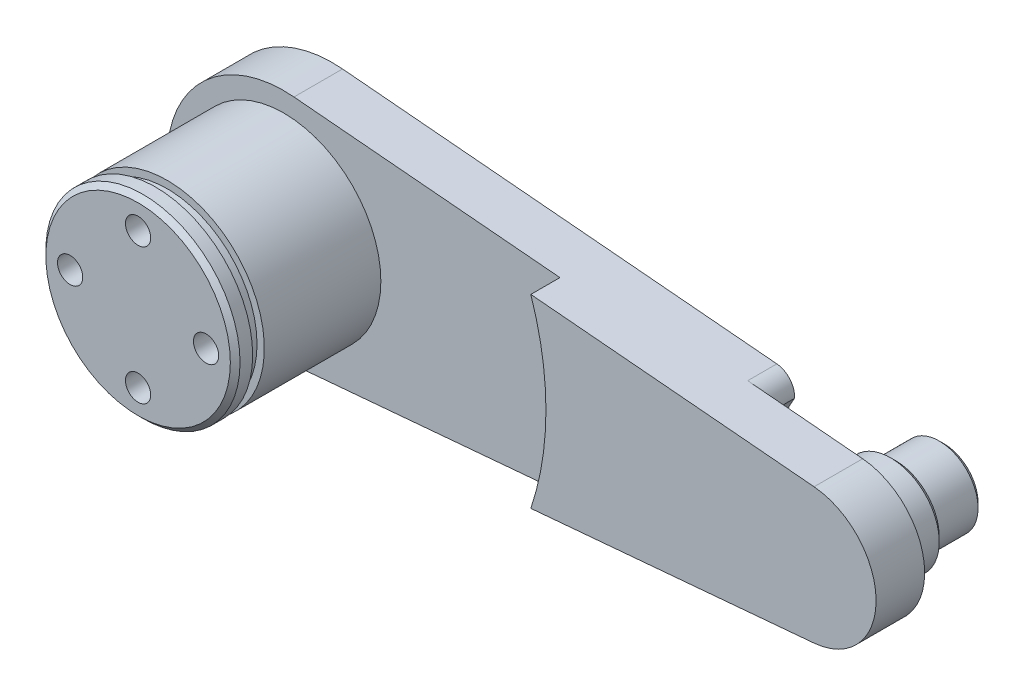
from build123d import *

# Parameters (mm, degrees)
EXTRUDE_1_DEPTH     = 5
SKETCH_2_R          = 10
EXTRUDE_2_DEPTH     = 15
SKETCH_3_R          = 4
EXTRUDE_3_DEPTH     = 6
SKETCH_4_R          = 5
SKETCH_4_R_2        = 4
EXTRUDE_4_DEPTH     = 1
CHAMFER_1_SIZE      = 0.5
SKETCH_6_R          = 1.3
CUT_EXTRUDE_2_DEPTH = 6
SKETCH_11_R         = 2.2
CUT_EXTRUDE_7_DEPTH = 10
CUT_EXTRUDE_START   = -5
CUT_EXTRUDE_8_DEPTH = 5
CUT_EXTRUDE_START_2 = -3
SKETCH_14_R         = 11.075
SKETCH_14_R_2       = 5
CUT_EXTRUDE_9_DEPTH = 3
EXTRUDE_START       = -1
EXTRUDE_5_DEPTH     = 1
FILLET_1_R          = 2
SKETCH_16_W         = 4.663078912
SKETCH_16_H         = 1.2
EXTRUDE_6_DEPTH     = 4
EXTRUDE_7_DEPTH     = 1
EXTRUDE_8_DEPTH     = 3


with BuildPart() as part:
    # 草图1 → 凸台-拉伸1 (new body)
    with BuildSketch(Plane.XY):
        with BuildLine():
            Line((57.614035088, 6.973016629), (1.052631579, 11.953742793))
            ThreePointArc((1.052631579, 11.953742793), (-12, 0), (1.052631579, -11.953742793))
            Line((1.052631579, -11.953742793), (57.614035088, -6.973016629))
            ThreePointArc((57.614035088, -6.973016629), (64, 0), (57.614035088, 6.973016629))
        make_face()
    extrude(amount=EXTRUDE_1_DEPTH)

    # 草图2 → 凸台-拉伸2 (add)
    with BuildSketch(Plane.XY.offset(5)):
        Circle(SKETCH_2_R)
    extrude(amount=EXTRUDE_2_DEPTH)

    # 草图3 → 凸台-拉伸3 (add)
    with BuildSketch(Plane(origin=(0, 0, 0), x_dir=(-1, 0, 0), z_dir=(0, 0, -1))):
        with Locations((-57, 0)):
            Circle(SKETCH_3_R)
    extrude(amount=EXTRUDE_3_DEPTH)

    # 草图4 → 凸台-拉伸4 (add)
    with BuildSketch(Plane(origin=(0, 0, 0), x_dir=(-1, 0, 0), z_dir=(0, 0, -1))):
        with Locations(Location((-57, 0, 0), (0, 0, 180))):
            Circle(SKETCH_4_R)
        with Locations((-57, 0)):
            Circle(SKETCH_4_R_2, mode=Mode.SUBTRACT)
    extrude(amount=EXTRUDE_4_DEPTH)

    # 倒角1
    chamfer_1_edges = [part.edges().sort_by_distance(p)[0] for p in [
        (-10, 0, 20),
        (61, 0, -6),
        (52, 0, -1),
    ]]
    chamfer(chamfer_1_edges, length=CHAMFER_1_SIZE)

    # 草图6 → 切除-拉伸2 (cut)
    with BuildSketch(Plane.XY.offset(20)):
        with Locations((0, 7)):
            Circle(SKETCH_6_R)
        with Locations((7, 0)):
            Circle(SKETCH_6_R)
        with Locations((0, -7)):
            Circle(SKETCH_6_R)
        with Locations((-7, 0)):
            Circle(SKETCH_6_R)
    extrude(amount=-CUT_EXTRUDE_2_DEPTH, mode=Mode.SUBTRACT)

    # 草图11 → 切除-拉伸7 (cut)
    with BuildSketch(Plane(origin=(0, 0, -6), x_dir=(-1, 0, 0), z_dir=(0, 0, -1))):
        with Locations((-57, 0)):
            Circle(SKETCH_11_R)
    extrude(amount=-CUT_EXTRUDE_7_DEPTH, mode=Mode.SUBTRACT)

    # 草图12 → 切除-拉伸8 (cut)
    with BuildSketch(Plane.XY.offset(5).offset(CUT_EXTRUDE_START)):
        with BuildLine():
            Line((57.438596491, 4.980726164), (7.48487293, 9.379588329))
            ThreePointArc((7.48487293, 9.379588329), (10.812457518, 5.204878713), (12, 0))
            ThreePointArc((12, 0), (10.812457518, -5.204878713), (7.48487293, -9.379588329))
            Line((7.48487293, -9.379588329), (57.438596491, -4.980726164))
            ThreePointArc((57.438596491, -4.980726164), (52, 0), (57.438596491, 4.980726164))
        make_face()
    extrude(amount=CUT_EXTRUDE_8_DEPTH, mode=Mode.SUBTRACT)

    # 草图14 → 切除-拉伸9 (cut)
    with BuildSketch(Plane(origin=(0, 0, 0), x_dir=(-1, 0, 0), z_dir=(0, 0, -1)).offset(CUT_EXTRUDE_START_2)):
        with Locations((-57, 0)):
            Circle(SKETCH_14_R)
        with Locations(Location((-57, 0, 0), (0, 0, 95.032413496))):
            Circle(SKETCH_14_R_2, mode=Mode.SUBTRACT)
    extrude(amount=CUT_EXTRUDE_9_DEPTH, mode=Mode.SUBTRACT)

    # 草图15 → 凸台-拉伸5 (add)
    with BuildSketch(Plane.XY.offset(5).offset(EXTRUDE_START)):
        with BuildLine():
            Line((1.052631579, -11.953742793), (57.614035088, -6.973016629))
            ThreePointArc((57.614035088, -6.973016629), (64, 0), (57.614035088, 6.973016629))
            Line((57.614035088, 6.973016629), (1.052631579, 11.953742793))
            ThreePointArc((1.052631579, 11.953742793), (-12, 0), (1.052631579, -11.953742793))
        make_face()
    extrude(amount=EXTRUDE_5_DEPTH)

    # 圆角1
    # the kernel refuses this fillet: 2 mm, written as the material it takes off along each edge
    with BuildSketch(Plane(origin=(49.064832266, -7.725848694, -8.249501326), x_dir=(-0.6163800221199659, 0.7874488353736963, 0), z_dir=(0, 0, 1))) as fillet_1_piece_1:
        with BuildLine():
            CenterArc((3.475122508, 1.676963653), FILLET_1_R, 146.980149767, 90)
            Line((1.798158856, 2.766822775), (0, 0))
            ThreePointArc((0, 0), (1.192631693, 0.064402621), (2.385263386, 0))
        make_face()
    extrude(amount=11.249501326, mode=Mode.SUBTRACT)
    with BuildSketch(Plane(origin=(49.064832266, 7.725848694, -8.249501326), x_dir=(-0.9961452327423431, 0.08771929824561424, 0), z_dir=(0, 0, 1))) as fillet_1_piece_2:
        with BuildLine():
            CenterArc((3.29980053, 2), FILLET_1_R, 180, 90)
            ThreePointArc((1.29980053, 2), (0.703900692, 0.964905108), (0, 0))
            Line((0, 0), (3.29980053, 0))
        make_face()
    extrude(amount=11.249501326, mode=Mode.SUBTRACT)

    # 草图16 → 切除-旋转1 (revolve, cut)
    with BuildSketch(Plane(origin=(0, 0, 0), x_dir=(1, 0, 0), z_dir=(0, 1, 0))):
        with Locations((11.581539456, -17.6)):
            Rectangle(SKETCH_16_W, SKETCH_16_H)
    revolve(axis=Axis((0, 0, 20), (0, 0, -1)), mode=Mode.SUBTRACT)

    # 草图17 → 凸台-拉伸6 (add)
    # profile 1 of 2: a face of its own
    with BuildSketch(Plane(origin=(0, 0, 4), x_dir=(-1, 0, 0), z_dir=(0, 0, -1))):
        with BuildLine():
            ThreePointArc((-7.48487293, -9.379588329), (-12, 0), (-7.48487293, 9.379588329))
            Line((-7.48487293, 9.379588329), (-47.594603568, 5.847575819))
            ThreePointArc((-47.594603568, 5.847575819), (-45.925, 0), (-47.594603568, -5.847575819))
            Line((-47.594603568, -5.847575819), (-7.48487293, -9.379588329))
        make_face()
        with BuildLine():
            Line((-43.563456974, -2.155807668), (-43.563456974, 2.155807668))
            Line((-43.563456974, 2.155807668), (-15.344753505, 4.640711258))
            ThreePointArc((-15.344753505, 4.640711258), (-16.031146594, 0), (-15.344753505, -4.640711258))
            Line((-15.344753505, -4.640711258), (-43.563456974, -2.155807668))
        make_face(mode=Mode.SUBTRACT)
    # profile 2 of 2: a face of its own
    with BuildSketch(Plane(origin=(0, 0, 4), x_dir=(-1, 0, 0), z_dir=(0, 0, -1))):
        with BuildLine():
            ThreePointArc((-15.344753505, 4.640711258), (-16.031146594, 0), (-15.344753505, -4.640711258))
            Line((-15.344753505, -4.640711258), (-43.563456974, -2.155807668))
            Line((-43.563456974, -2.155807668), (-43.563456974, 2.155807668))
            Line((-43.563456974, 2.155807668), (-15.344753505, 4.640711258))
        make_face()
    extrude(amount=EXTRUDE_6_DEPTH)

    # 草图18 → 凸台-拉伸7 (add)
    with BuildSketch(Plane(origin=(0, 0, 4), x_dir=(-1, 0, 0), z_dir=(0, 0, -1))):
        with BuildLine():
            Line((-47.594603568, 5.847575819), (-57.438596491, 4.980726164))
            ThreePointArc((-57.438596491, 4.980726164), (-52, 0), (-57.438596491, -4.980726164))
            Line((-57.438596491, -4.980726164), (-47.594603568, -5.847575819))
            ThreePointArc((-47.594603568, -5.847575819), (-45.925, 0), (-47.594603568, 5.847575819))
        make_face()
    extrude(amount=EXTRUDE_7_DEPTH)

    # 草图19 → 凸台-拉伸8 (add)
    with BuildSketch(Plane.XY.offset(5)):
        with BuildLine():
            Line((28.442097172, -9.541860848), (57.614035088, -6.973016629))
            ThreePointArc((57.614035088, -6.973016629), (64, 0), (57.614035088, 6.973016629))
            Line((57.614035088, 6.973016629), (28.442097172, 9.541860848))
            ThreePointArc((28.442097172, 9.541860848), (30, 0), (28.442097172, -9.541860848))
        make_face()
    extrude(amount=EXTRUDE_8_DEPTH)


solid = part.part
